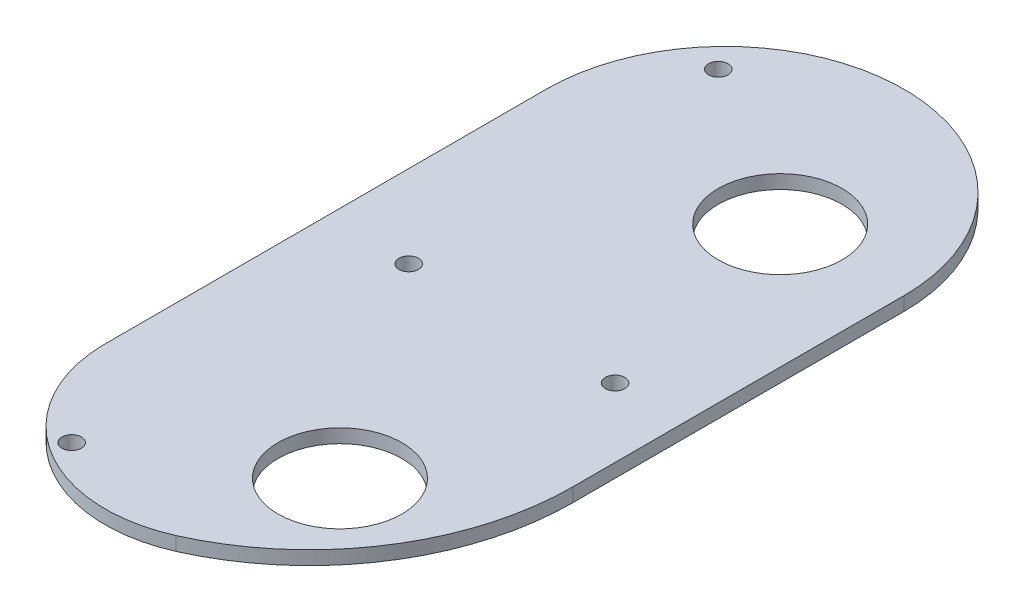
from build123d import *

# Parameters (mm, degrees)
SKETCH1_R                 = 14.2875
BOSS_EXTRUDE1_DEPTH       = 3.175
F_8_CLEARANCE_HOLE1_D     = 4.4958
F_8_CLEARANCE_HOLE1_DEPTH = 3.175
F_8_CLEARANCE_HOLE1_TIP   = 1.350674586


with BuildPart() as part:
    # Sketch1 → Boss-Extrude1 (new body)
    with BuildSketch(Plane(origin=(0, 0, 0), x_dir=(1, 0, 0), z_dir=(0, 1, 0))):
        with BuildLine():
            Line((-53.970534123, 50.8), (-53.970534123, -50.8))
            ThreePointArc((-53.970534123, -50.8), (-53.967584126, -51.293444242), (-53.958734556, -51.786817942))
            ThreePointArc((-53.958734556, -51.786817942), (-38.601100873, -78.902378346), (-7.520619165, -81.163834778))
            ThreePointArc((-7.520619165, -81.163834778), (18.755925223, -58.724808424), (28.570534123, -25.594155838))
            Line((28.570534123, -25.594155838), (28.570534123, 50.8))
            ThreePointArc((28.570534123, 50.8), (-12.7, 92.070534123), (-53.970534123, 50.8))
        make_face()
        with Locations((0, 50.8)):
            Circle(SKETCH1_R, mode=Mode.SUBTRACT)
        with Locations((0, -50.8)):
            Circle(SKETCH1_R, mode=Mode.SUBTRACT)
    extrude(amount=BOSS_EXTRUDE1_DEPTH)

    # #8 Clearance Hole1
    with Locations(Plane(origin=(0, 3.175, 0), x_dir=(1, 0, 0), z_dir=(0, 1, 0))):
        with Locations((12.7, 0), (-38.1, 74.6125), (-38.1, -74.6125), (-34.925, 0)):
            Hole(F_8_CLEARANCE_HOLE1_D / 2, depth=F_8_CLEARANCE_HOLE1_DEPTH)
            with Locations((0, 0, -(F_8_CLEARANCE_HOLE1_DEPTH + F_8_CLEARANCE_HOLE1_TIP / 2))):  # 118° drill point
                Cone(0, F_8_CLEARANCE_HOLE1_D / 2, F_8_CLEARANCE_HOLE1_TIP, mode=Mode.SUBTRACT)


solid = part.part
